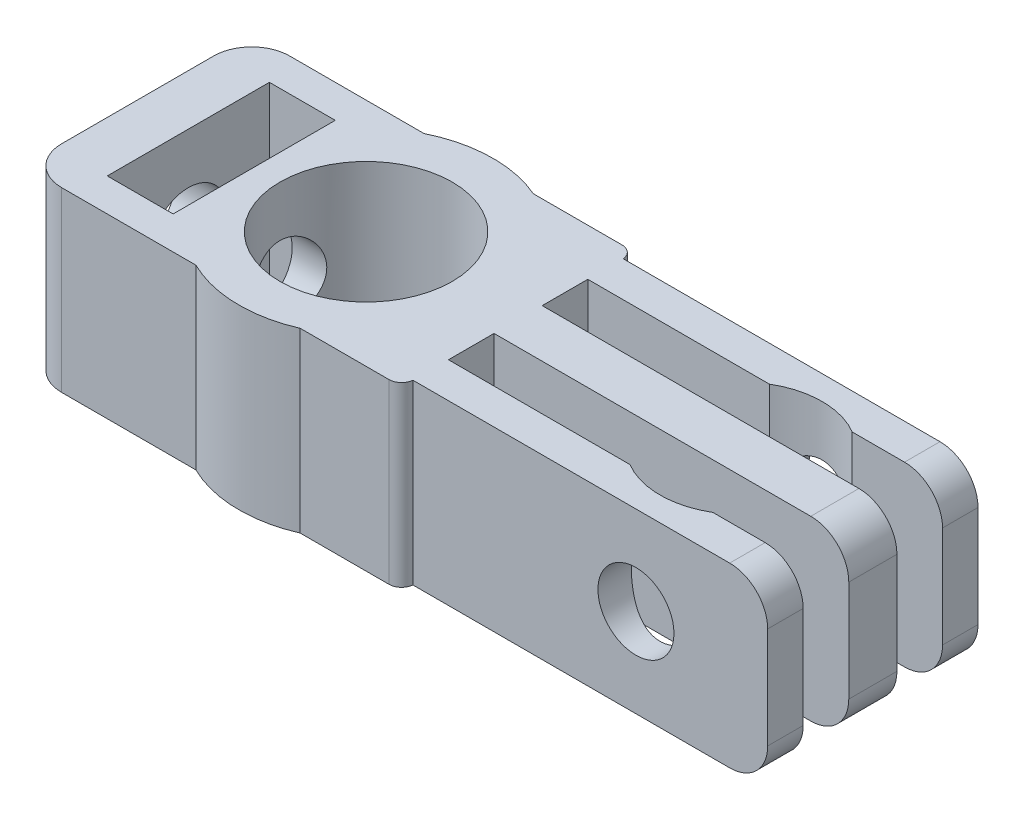
from build123d import *

# Parameters (mm, degrees)
SKETCH1_W               = 5.08
SKETCH1_H               = 11.684
BOSS_EXTRUDE1_DEPTH     = 8.89
SKETCH2_R               = 4.318
CUT_EXTRUDE1_DEPTH      = 8.89
BOSS_EXTRUDE4_START     = -8.89
BOSS_EXTRUDE4_DEPTH     = 8.89
BOSS_EXTRUDE5_START     = -8.89
BOSS_EXTRUDE5_DEPTH     = 8.89
SKETCH9_W               = 3.302
SKETCH9_H               = 8.128
CUT_EXTRUDE4_DEPTH      = 8.89
CUT_EXTRUDE5_REACH      = 23.984
CUT_EXTRUDE5_END_RADIUS = 4.318
SKETCH10_R              = 1.905
SKETCH11_W              = 2.413
SKETCH11_H              = 8.89
SKETCH11_W_2            = 1.778
BOSS_EXTRUDE6_DEPTH     = 17.78
CUT_EXTRUDE6_REACH      = 27.049
SKETCH12_R              = 1.905
CUT_EXTRUDE7_START      = -8.89
CUT_EXTRUDE7_DEPTH      = 8.89
FILLET3_R               = 0.635
FILLET4_R               = 1.905


with BuildPart() as part:
    # Sketch1 → Boss-Extrude1 (new body)
    with BuildSketch(Plane(origin=(0, 0, 0), x_dir=(1, 0, 0), z_dir=(0, 1, 0))):
        Rectangle(SKETCH1_W, SKETCH1_H)
    extrude(amount=BOSS_EXTRUDE1_DEPTH)

    # Sketch2 → Cut-Extrude1 (cut)
    with BuildSketch(Plane(origin=(0, 8.89, 0), x_dir=(1, 0, 0), z_dir=(0, 1, 0))):
        with Locations((-5.08, 0)):
            Circle(SKETCH2_R)
    extrude(amount=-CUT_EXTRUDE1_DEPTH, mode=Mode.SUBTRACT)

    # Sketch7 → Boss-Extrude4 (add)
    with BuildSketch(Plane.XZ.offset(BOSS_EXTRUDE4_START)):
        with BuildLine():
            Line((-2.54, 3.49192268), (-2.54, 5.842))
            ThreePointArc((-2.54, 5.842), (-11.450287592, 0), (-2.54, -5.842))
            Line((-2.54, -5.842), (-2.54, -3.49192268))
            ThreePointArc((-2.54, -3.49192268), (-9.398, 0), (-2.54, 3.49192268))
        make_face()
    extrude(amount=BOSS_EXTRUDE4_DEPTH)

    # Sketch8 → Boss-Extrude5 (add)
    with BuildSketch(Plane.XZ.offset(BOSS_EXTRUDE5_START)):
        with BuildLine():
            Line((-7.894132015, 5.715), (-16.530287592, 5.715))
            Line((-16.530287592, 5.715), (-16.530287592, -5.715))
            Line((-16.530287592, -5.715), (-7.894132015, -5.715))
            ThreePointArc((-7.894132015, -5.715), (-11.450287592, 0), (-7.894132015, 5.715))
        make_face()
    extrude(amount=BOSS_EXTRUDE5_DEPTH)

    # Sketch9 → Cut-Extrude4 (cut)
    with BuildSketch(Plane.XZ):
        with Locations((-12.339287592, 0)):
            Rectangle(SKETCH9_W, SKETCH9_H)
    extrude(amount=-CUT_EXTRUDE4_DEPTH, mode=Mode.SUBTRACT)

    # Cut-Extrude5: up to this cylinder (the profile starts outside it)
    cut_extrude5_end = Plane(origin=(-5.08, 4.445, 0), z_dir=(0, 1, 0)) * Cylinder(CUT_EXTRUDE5_END_RADIUS, 57.604, mode=Mode.PRIVATE)
    # Sketch10 → Cut-Extrude5 (cut, up to the surface)
    with BuildSketch(Plane.ZY.offset(16.530287592), mode=Mode.PRIVATE) as cut_extrude5_sk1:
        with Locations((0, 4.445)):
            Circle(SKETCH10_R)
    cut_extrude5_tool1 = extrude(cut_extrude5_sk1.sketch, amount=-CUT_EXTRUDE5_REACH, mode=Mode.PRIVATE) - cut_extrude5_end
    add(cut_extrude5_tool1.solids().sort_by_distance((-16.530288, 4.445, 0))[0], mode=Mode.SUBTRACT)

    # Sketch11 → Boss-Extrude6 (add)
    with BuildSketch(Plane(origin=(2.54, 0, 0), x_dir=(0, 0, -1), z_dir=(1, 0, 0))):
        with Locations((0, 4.445)):
            Rectangle(SKETCH11_W, SKETCH11_H)
        with Locations((4.3815, 4.445)):
            Rectangle(SKETCH11_W_2, SKETCH11_H)
        with Locations((-4.3815, 4.445)):
            Rectangle(SKETCH11_W_2, SKETCH11_H)
    extrude(amount=BOSS_EXTRUDE6_DEPTH)

    # Cut-Extrude6: up to this face of the body (flat: up to its plane)
    cut_extrude6_end = Plane(part.part.faces().sort_by_distance((11.43, 4.445, -5.2705))[0])
    # Sketch12 → Cut-Extrude6 (cut, up to the picked face)
    with BuildSketch(Plane.XY.offset(5.2705), mode=Mode.PRIVATE) as cut_extrude6_sk1:
        with Locations((13.716, 4.445)):
            Circle(SKETCH12_R)
    cut_extrude6_tool1 = split(extrude(cut_extrude6_sk1.sketch, amount=-CUT_EXTRUDE6_REACH, mode=Mode.PRIVATE), bisect_by=cut_extrude6_end, keep=Keep.BOTH, mode=Mode.PRIVATE)
    add(cut_extrude6_tool1.solids().sort_by(Axis((13.716, 4.445, 5.2705), (0, 0, -1)))[0], mode=Mode.SUBTRACT)

    # Sketch13 → Cut-Extrude7 (cut)
    with BuildSketch(Plane(origin=(0, 8.89, 0), x_dir=(1, 0, 0), z_dir=(0, 1, 0)).offset(CUT_EXTRUDE7_START)):
        with BuildLine():
            Line((11.637890342, 3.4925), (15.794109658, 3.4925))
            ThreePointArc((15.794109658, 3.4925), (13.716, 4.064), (11.637890342, 3.4925))
        make_face()
        with BuildLine():
            Line((11.637890342, -3.4925), (15.794109658, -3.4925))
            ThreePointArc((15.794109658, -3.4925), (13.716, -4.064), (11.637890342, -3.4925))
        make_face()
    extrude(amount=CUT_EXTRUDE7_DEPTH, mode=Mode.SUBTRACT)

    # Fillet3
    # the kernel refuses this fillet: 0.635 mm, written as the material it takes off along each edge
    with BuildSketch(Plane(origin=(2.54, -1.579542556, -5.842), x_dir=(-1, 0, 0), z_dir=(0, 1, 0))) as fillet3_piece_1:
        with BuildLine():
            CenterArc((0.631817023, 0.635), FILLET3_R, 185.739170477, 84.260829523)
            Line((0, 0.5715), (-0.01263634, 0.57023))
            ThreePointArc((-0.01263634, 0.57023), (-0.0127, 0.28575), (-0.0127, 0))
            Line((-0.0127, 0), (0, -0.0127))
            Line((0, -0.0127), (0.631817023, -0.0127))
            Line((0.631817023, -0.0127), (0.631817023, 0))
        make_face()
    extrude(amount=12.049085113, mode=Mode.SUBTRACT)
    with BuildSketch(Plane(origin=(2.54, -1.579542556, 5.842), x_dir=(-1, 0, 0), z_dir=(0, 1, 0))) as fillet3_piece_2:
        with BuildLine():
            CenterArc((0.631817023, -0.635), FILLET3_R, 90, 84.260829523)
            Line((0, -0.5715), (-0.01263634, -0.57023))
            ThreePointArc((-0.01263634, -0.57023), (-0.0127, -0.28575), (-0.0127, 0))
            Line((-0.0127, 0), (0, 0.0127))
            Line((0, 0.0127), (0.631817023, 0.0127))
            Line((0.631817023, 0.0127), (0.631817023, 0))
        make_face()
    extrude(amount=12.049085113, mode=Mode.SUBTRACT)

    # Fillet4
    fillet4_edges = [part.edges().sort_by_distance(p)[0] for p in [
        (-16.530287592, 4.445, 5.715),
        (-16.530287592, 4.445, -5.715),
        (20.32, 0, 0),
        (20.32, 8.89, 0),
        (20.32, 8.89, -4.3815),
        (20.32, 0, -4.3815),
        (20.32, 0, 4.3815),
        (20.32, 8.89, 4.3815),
    ]]
    fillet(fillet4_edges, radius=FILLET4_R)


solid = part.part
